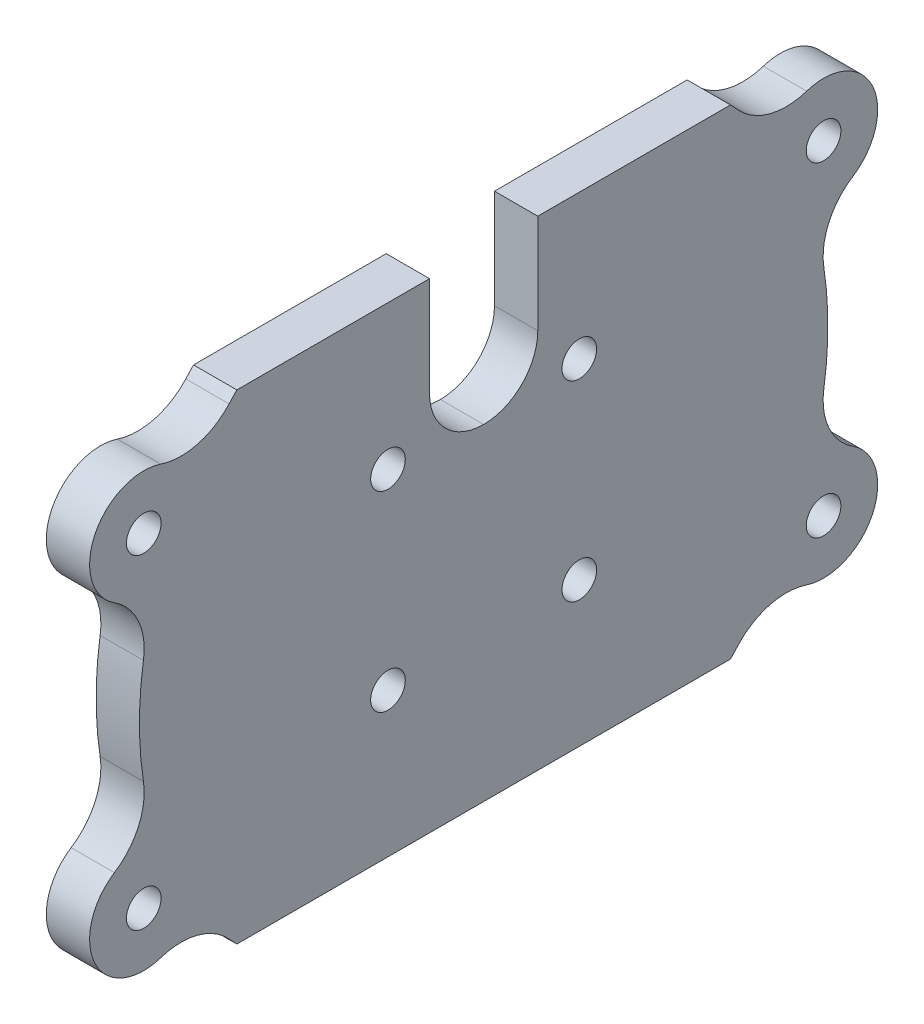
from build123d import *

# Parameters (mm, degrees)
BOSS_EXTRUDE1_START                                 = -50
BOSS_EXTRUDE1_DEPTH                                 = 4
CSK_FOR_M3_COUNTERSUNK_FLAT_HEAD_SCREW1_D           = 3.2
CSK_FOR_M3_COUNTERSUNK_FLAT_HEAD_SCREW1_CSINK_D     = 6.3
CSK_FOR_M3_COUNTERSUNK_FLAT_HEAD_SCREW1_CSINK_ANGLE = 90
M3_CLEARANCE_HOLE1_D                                = 3.2
FILLET1_R                                           = 5


with BuildPart() as part:
    # Sketch2 → Boss-Extrude1 (new body)
    with BuildSketch(Plane(origin=(0, 0, 0), x_dir=(0, 0, -1), z_dir=(1, 0, 0)).offset(BOSS_EXTRUDE1_START)):
        with BuildLine():
            Line((5, 8), (5, 22.167543842))
            Line((5, 22.167543842), (22.8, 22.167543842))
            ThreePointArc((22.8, 22.167543842), (23.161099135, 21.78998593), (23.515946886, 21.40654671))
            ThreePointArc((23.515946886, 21.40654671), (26.429411238, 19.642162968), (29.833839376, 19.747962631))
            ThreePointArc((29.833839376, 19.747962631), (35.912951138, 17.155172414), (34.109592252, 10.797023497))
            ThreePointArc((34.109592252, 10.797023497), (31.887887506, 8.215289092), (31.429483161, 4.840205393))
            ThreePointArc((31.429483161, 4.840205393), (31.8, 0), (31.429483161, -4.840205393))
            ThreePointArc((31.429483161, -4.840205393), (31.887887506, -8.215289092), (34.109592252, -10.797023497))
            ThreePointArc((34.109592252, -10.797023497), (35.912951138, -17.155172414), (29.833839376, -19.747962631))
            ThreePointArc((29.833839376, -19.747962631), (26.429411238, -19.642162968), (23.515946886, -21.40654671))
            ThreePointArc((23.515946886, -21.40654671), (23.161099135, -21.78998593), (22.8, -22.167543842))
            Line((22.8, -22.167543842), (-22.8, -22.167543842))
            ThreePointArc((-22.8, -22.167543842), (-23.161099135, -21.78998593), (-23.515946886, -21.40654671))
            ThreePointArc((-23.515946886, -21.40654671), (-26.429411238, -19.642162968), (-29.833839376, -19.747962631))
            ThreePointArc((-29.833839376, -19.747962631), (-35.912951138, -17.155172414), (-34.109592252, -10.797023497))
            ThreePointArc((-34.109592252, -10.797023497), (-31.887887506, -8.215289092), (-31.429483161, -4.840205393))
            ThreePointArc((-31.429483161, -4.840205393), (-31.8, 0), (-31.429483161, 4.840205393))
            ThreePointArc((-31.429483161, 4.840205393), (-31.887887506, 8.215289092), (-34.109592252, 10.797023497))
            ThreePointArc((-34.109592252, 10.797023497), (-35.912951138, 17.155172414), (-29.833839376, 19.747962631))
            ThreePointArc((-29.833839376, 19.747962631), (-26.429411238, 19.642162968), (-23.515946886, 21.40654671))
            ThreePointArc((-23.515946886, 21.40654671), (-23.161099135, 21.78998593), (-22.8, 22.167543842))
            Line((-22.8, 22.167543842), (-5, 22.167543842))
            Line((-5, 22.167543842), (-5, 8))
            Line((-5, 8), (5, 8))
        make_face()
    extrude(amount=BOSS_EXTRUDE1_DEPTH)

    # CSK for M3 Countersunk Flat Head Screw1 (through all)
    with Locations(Plane.ZY.offset(50)):
        with Locations((-31.40127386, 15), (-31.40127386, -15), (31.40127386, 15), (31.40127386, -15)):
            CounterSinkHole(CSK_FOR_M3_COUNTERSUNK_FLAT_HEAD_SCREW1_D / 2, CSK_FOR_M3_COUNTERSUNK_FLAT_HEAD_SCREW1_CSINK_D / 2, counter_sink_angle=CSK_FOR_M3_COUNTERSUNK_FLAT_HEAD_SCREW1_CSINK_ANGLE)

    # M3 Clearance Hole1 (through all)
    with Locations(Plane.ZY.offset(50)):
        with Locations((-8.838834765, 8.838834765), (-8.838834765, -8.838834765), (8.838834765, -8.838834765), (8.838834765, 8.838834765)):
            Hole(M3_CLEARANCE_HOLE1_D / 2)

    # Fillet1
    fillet1_edges = [part.edges().sort_by_distance(p)[0] for p in [
        (-48, 8, 5),
        (-48, 8, -5),
    ]]
    fillet(fillet1_edges, radius=FILLET1_R - 0.0001)  # a hair under: the kernel refuses the full size


solid = part.part
